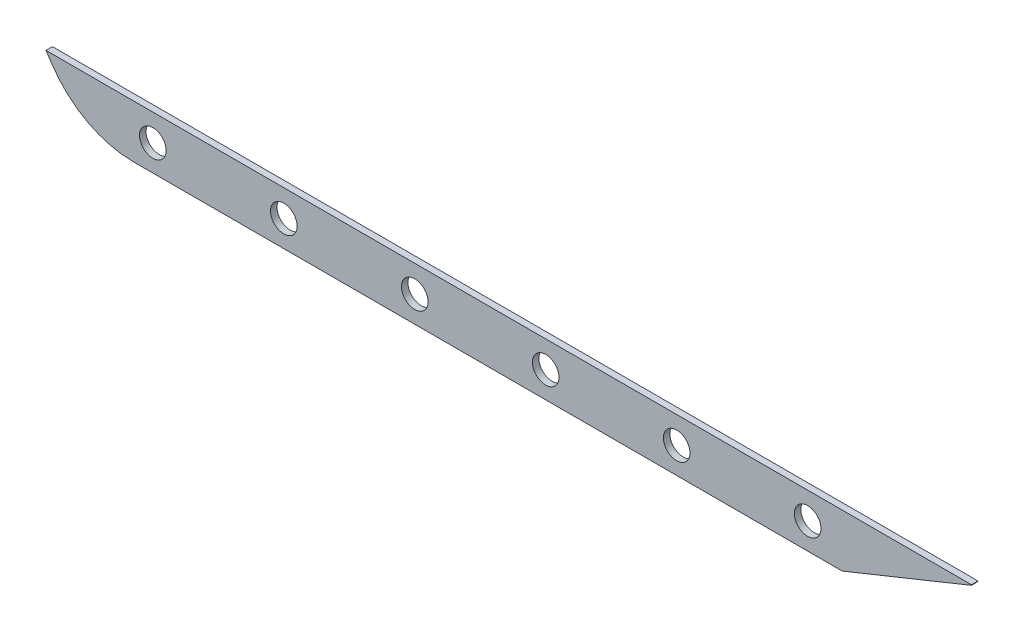
from build123d import *

# Parameters (mm, degrees)
BOSS_EXTRUDE1_DEPTH = 3.175
SKETCH1_4_R         = 6.5
CUT_EXTRUDE1_DEPTH  = 439.905857431
FILLET1_R           = 48
CUT_EXTRUDE3_DEPTH  = 10
CUT_EXTRUDE5_DEPTH  = 10


with BuildPart() as part:
    # Sketch1 → Boss-Extrude1 (new body)
    with BuildSketch(Plane.XY):
        Polygon((428.120588235, 28.939617947), (0.540381846, 28.939617947), (-115.605170134, 28.939617947), (-98.879411765, 3.850980392), (-31.879411765, -96.649019608), (366, -96.649019608), (403.120588235, -71.149019608), align=None)
    extrude(amount=BOSS_EXTRUDE1_DEPTH)

    # Sketch1<4> → Cut-Extrude1 (cut, through all)
    with BuildSketch(Plane.XY):
        with Locations((3.120588235, -83.899019608)):
            Circle(SKETCH1_4_R)
        with Locations((67.120588235, -83.899019608)):
            Circle(SKETCH1_4_R)
        with Locations((131.120588235, -83.899019608)):
            Circle(SKETCH1_4_R)
        with Locations((195.120588235, -83.899019608)):
            Circle(SKETCH1_4_R)
        with Locations((259.120588235, -83.899019608)):
            Circle(SKETCH1_4_R)
        with Locations((323.120588235, -83.899019608)):
            Circle(SKETCH1_4_R)
    extrude(amount=CUT_EXTRUDE1_DEPTH, mode=Mode.SUBTRACT)

    # Fillet1
    fillet1_edges = [part.edges().sort_by_distance(p)[0] for p in [
        (-31.879411765, -96.649019608, 1.5875),
    ]]
    fillet(fillet1_edges, radius=FILLET1_R)

    # Sketch7 → Cut-Extrude3 (cut)
    with BuildSketch(Plane.XY.offset(3.175)):
        Polygon((403.120588235, -71.149019608), (340.005873473, -96.649019608), (366, -96.649019608), align=None)
    extrude(amount=-CUT_EXTRUDE3_DEPTH, mode=Mode.SUBTRACT)

    # Sketch11 → Cut-Extrude5 (cut)
    with BuildSketch(Plane.XY.offset(3.175)):
        Polygon((-49.086078431, -70.839019608), (403.198019602, -70.839019608), (428.120588235, 28.939617947), (-115.605170134, 28.939617947), align=None)
    extrude(amount=-CUT_EXTRUDE5_DEPTH, mode=Mode.SUBTRACT)


solid = part.part
